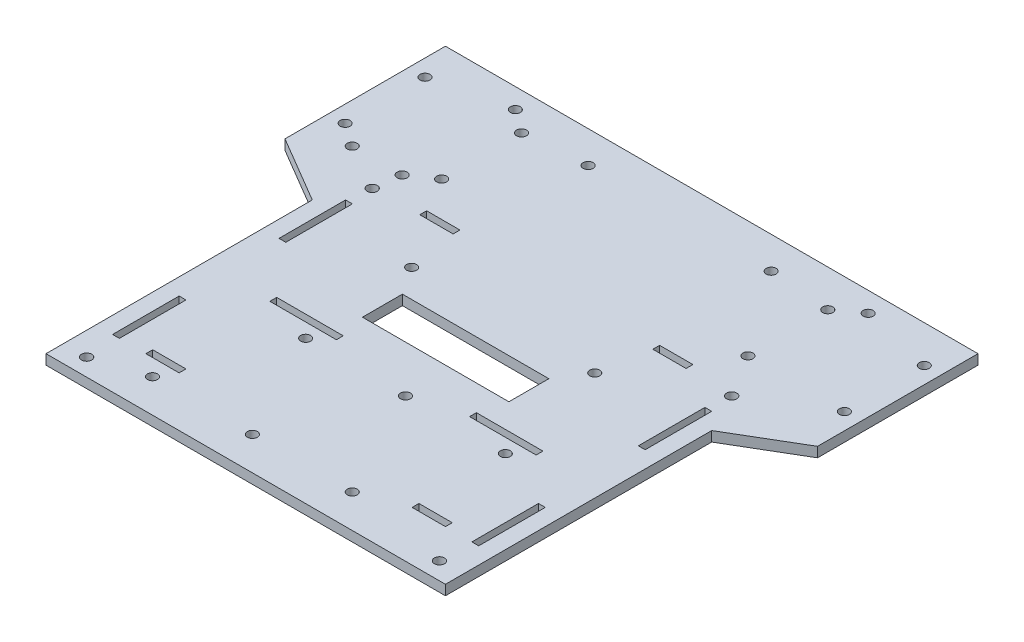
from build123d import *

# Parameters (mm, degrees)
BOSS_EXTRUDE1_DEPTH = 3
SKETCH2_R           = 1.5
CUT_EXTRUDE1_DEPTH  = 107.343782141
SKETCH3_R           = 1.5
CUT_EXTRUDE3_DEPTH  = 107.343782141
SKETCH4_R           = 1.5
CUT_EXTRUDE4_DEPTH  = 107.343782141
SKETCH5_R           = 1.5
CUT_EXTRUDE5_DEPTH  = 3
SKETCH6_R           = 1.525
SKETCH6_W           = 10
SKETCH6_H           = 2.05
SKETCH6_W_2         = 20
CUT_EXTRUDE7_DEPTH  = 107.343782141
SKETCH9_R           = 1.525
CUT_EXTRUDE8_DEPTH  = 3
SKETCH10_W          = 44
SKETCH10_H          = 12
CUT_EXTRUDE9_DEPTH  = 5
SKETCH11_R          = 1.5
CUT_EXTRUDE10_DEPTH = 5
SKETCH12_W          = 2.05
SKETCH12_H          = 20
CUT_EXTRUDE11_DEPTH = 10


with BuildPart() as part:
    # Sketch1 → Boss-Extrude1 (new body)
    with BuildSketch(Plane(origin=(0, 0, 0), x_dir=(1, 0, 0), z_dir=(0, 1, 0))):
        Polygon((-80, 70), (-80, 21.791828604), (-60, 10), (-60, -70), (60, -70), (60, 10), (80, 21.791828604), (80, 70), align=None)
    extrude(amount=BOSS_EXTRUDE1_DEPTH)

    # Sketch2 → Cut-Extrude1 (cut, through all)
    with BuildSketch(Plane(origin=(0, 3, 0), x_dir=(1, 0, 0), z_dir=(0, 1, 0))):
        with Locations((-38, -60)):
            Circle(SKETCH2_R)
        with Locations((-25, -27)):
            Circle(SKETCH2_R)
        with Locations((5, -27)):
            Circle(SKETCH2_R)
        with Locations((-8, -60)):
            Circle(SKETCH2_R)
        with Locations((35, -27)):
            Circle(SKETCH2_R)
        with Locations((22, -60)):
            Circle(SKETCH2_R)
    extrude(amount=-CUT_EXTRUDE1_DEPTH, mode=Mode.SUBTRACT)

    # Sketch3 → Cut-Extrude3 (cut, through all)
    with BuildSketch(Plane(origin=(0, 3, 0), x_dir=(1, 0, 0), z_dir=(0, 1, 0))):
        with Locations((-27.529579069, 60.385555627)):
            Circle(SKETCH3_R)
        with Locations((-27.529579069, 7.385555627)):
            Circle(SKETCH3_R)
        with Locations((27.470420931, 7.385555627)):
            Circle(SKETCH3_R)
        with Locations((27.470420931, 60.385555627)):
            Circle(SKETCH3_R)
    extrude(amount=-CUT_EXTRUDE3_DEPTH, mode=Mode.SUBTRACT)

    # Sketch4 → Cut-Extrude4 (cut, through all)
    with BuildSketch(Plane(origin=(0, 3, 0), x_dir=(1, 0, 0), z_dir=(0, 1, 0))):
        with Locations((-75, 34.863883517)):
            Circle(SKETCH4_R)
        with Locations((-75, 58.863883517)):
            Circle(SKETCH4_R)
        with Locations((-46, 34.863883517)):
            Circle(SKETCH4_R)
        with Locations((-46, 58.863883517)):
            Circle(SKETCH4_R)
        with Locations((46, 58.863883517)):
            Circle(SKETCH4_R)
        with Locations((46, 34.863883517)):
            Circle(SKETCH4_R)
        with Locations((75, 34.863883517)):
            Circle(SKETCH4_R)
        with Locations((75, 58.863883517)):
            Circle(SKETCH4_R)
    extrude(amount=-CUT_EXTRUDE4_DEPTH, mode=Mode.SUBTRACT)

    # Sketch5 → Cut-Extrude5 (cut)
    with BuildSketch(Plane(origin=(0, 3, 0), x_dir=(1, 0, 0), z_dir=(0, 1, 0))):
        with Locations((-68, 30)):
            Circle(SKETCH5_R)
        with Locations((-53, 30)):
            Circle(SKETCH5_R)
    extrude(amount=-CUT_EXTRUDE5_DEPTH, mode=Mode.SUBTRACT)

    # Sketch6 → Cut-Extrude7 (cut, through all)
    with BuildSketch(Plane(origin=(0, 3, 0), x_dir=(1, 0, 0), z_dir=(0, 1, 0))):
        with Locations((-53, -64.8)):
            Circle(SKETCH6_R)
        with Locations((53, -64.8)):
            Circle(SKETCH6_R)
        with Locations((-40, -53.975)):
            Rectangle(SKETCH6_W, SKETCH6_H)
        with Locations((40, -53.975)):
            Rectangle(SKETCH6_W, SKETCH6_H)
        with Locations((30, -21.725)):
            Rectangle(SKETCH6_W_2, SKETCH6_H)
        with Locations((-30, -21.725)):
            Rectangle(SKETCH6_W_2, SKETCH6_H)
        with Locations((35, 23.325)):
            Rectangle(SKETCH6_W, SKETCH6_H)
        with Locations((-35, 23.325)):
            Rectangle(SKETCH6_W, SKETCH6_H)
    extrude(amount=-CUT_EXTRUDE7_DEPTH, mode=Mode.SUBTRACT)

    # Sketch9 → Cut-Extrude8 (cut)
    with BuildSketch(Plane(origin=(0, 3, 0), x_dir=(1, 0, 0), z_dir=(0, 1, 0))):
        with Locations((-54, 22)):
            Circle(SKETCH9_R)
        with Locations((54, 22)):
            Circle(SKETCH9_R)
    extrude(amount=-CUT_EXTRUDE8_DEPTH, mode=Mode.SUBTRACT)

    # Sketch10 → Cut-Extrude9 (cut)
    with BuildSketch(Plane(origin=(0, 3, 0), x_dir=(1, 0, 0), z_dir=(0, 1, 0))):
        with Locations((0.046472237, -6.975074484)):
            Rectangle(SKETCH10_W, SKETCH10_H)
    extrude(amount=-CUT_EXTRUDE9_DEPTH, mode=Mode.SUBTRACT)

    # Sketch11 → Cut-Extrude10 (cut)
    with BuildSketch(Plane(origin=(0, 3, 0), x_dir=(1, 0, 0), z_dir=(0, 1, 0))):
        with Locations((-53, 64)):
            Circle(SKETCH11_R)
        with Locations((53, 64)):
            Circle(SKETCH11_R)
    extrude(amount=-CUT_EXTRUDE10_DEPTH, mode=Mode.SUBTRACT)

    # Sketch12 → Cut-Extrude11 (cut)
    with BuildSketch(Plane(origin=(0, 3, 0), x_dir=(1, 0, 0), z_dir=(0, 1, 0))):
        with Locations((-53.975, 5)):
            Rectangle(SKETCH12_W, SKETCH12_H)
        with Locations((-53.975, -45)):
            Rectangle(SKETCH12_W, SKETCH12_H)
        with Locations((53.975, -45)):
            Rectangle(SKETCH12_W, SKETCH12_H)
        with Locations((53.975, 5)):
            Rectangle(SKETCH12_W, SKETCH12_H)
    extrude(amount=-CUT_EXTRUDE11_DEPTH, mode=Mode.SUBTRACT)


solid = part.part
